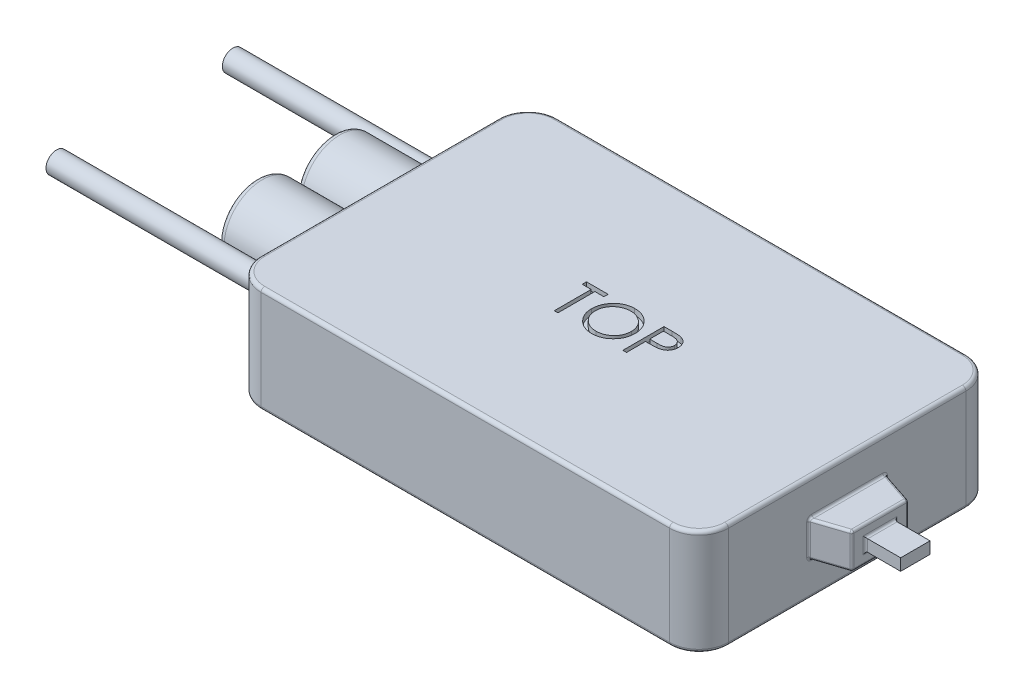
from build123d import *

# Parameters (mm, degrees)
SKETCH1_W                = 39.75
SKETCH1_H                = 25.2
BOSS_EXTRUDE1_DEPTH      = 9
BOSS_EXTRUDE2_DEPTH      = 1.5
BOSS_EXTRUDE2_DEPTH_BACK = 1.5
SKETCH5_W                = 2.5
SKETCH5_H                = 1
BOSS_EXTRUDE3_DEPTH      = 3
SKETCH6_R                = 3.25
BOSS_EXTRUDE5_DEPTH      = 7.2
SKETCH7_R                = 0.9
BOSS_EXTRUDE6_DEPTH      = 20
FILLET1_R                = 2.5
FILLET2_R                = 0.3
FILLET3_R                = 0.5
FILLET4_R                = 0.2
CUT_EXTRUDE1_DEPTH       = 0.5


with BuildPart() as part:
    # Sketch1 → Boss-Extrude1 (new body)
    with BuildSketch(Plane(origin=(0, 0, 0), x_dir=(1, 0, 0), z_dir=(0, 1, 0))):
        Rectangle(SKETCH1_W, SKETCH1_H)
    extrude(amount=BOSS_EXTRUDE1_DEPTH)

    # Sketch4 → Boss-Extrude2 (add, two sides: drawn at the far end of the back side and taken through both)
    with BuildSketch(Plane(origin=(0, 4.5, 0), x_dir=(-1, 0, 0), z_dir=(0, -1, 0)).offset(-BOSS_EXTRUDE2_DEPTH_BACK)):
        Polygon((-19.875, 3.3), (-22.675, 2.375), (-22.675, -2.375), (-19.875, -3.3), align=None)
    extrude(amount=BOSS_EXTRUDE2_DEPTH + BOSS_EXTRUDE2_DEPTH_BACK)

    # Sketch5 → Boss-Extrude3 (add)
    with BuildSketch(Plane(origin=(22.675, 0, 0), x_dir=(0, 0, -1), z_dir=(1, 0, 0))):
        with Locations((0, 4.5)):
            Rectangle(SKETCH5_W, SKETCH5_H)
    extrude(amount=BOSS_EXTRUDE3_DEPTH)

    # Sketch6 → Boss-Extrude5 (add)
    with BuildSketch(Plane.ZY.offset(19.875)):
        with Locations((-3.3, 4.5)):
            Circle(SKETCH6_R)
        with Locations((3.3, 4.5)):
            Circle(SKETCH6_R)
    extrude(amount=BOSS_EXTRUDE5_DEPTH)

    # Sketch7 → Boss-Extrude6 (add)
    with BuildSketch(Plane.ZY.offset(19.875)):
        with Locations((-7.5, 4.5)):
            Circle(SKETCH7_R)
        with Locations((7.5, 4.5)):
            Circle(SKETCH7_R)
    extrude(amount=BOSS_EXTRUDE6_DEPTH)

    # Fillet1
    fillet1_edges = [part.edges().sort_by_distance(p)[0] for p in [
        (19.875, 4.5, -12.6),
        (19.875, 4.5, 12.6),
        (-19.875, 4.5, 12.6),
        (-19.875, 4.5, -12.6),
    ]]
    fillet(fillet1_edges, radius=FILLET1_R)

    # Fillet2
    fillet2_edges = [part.edges().sort_by_distance(p)[0] for p in [
        (-19.142766953, 0, -11.867766953),
        (-19.875, 0, 0),
        (-19.142766953, 0, 11.867766953),
        (0, 0, 12.6),
        (19.142766953, 0, 11.867766953),
        (19.875, 0, 0),
        (19.142766953, 0, -11.867766953),
        (0, 0, -12.6),
        (19.142766953, 9, 11.867766953),
        (0, 9, 12.6),
        (-19.142766953, 9, 11.867766953),
        (-19.875, 9, 0),
        (-19.142766953, 9, -11.867766953),
        (0, 9, -12.6),
        (19.142766953, 9, -11.867766953),
        (19.875, 9, 0),
    ]]
    fillet(fillet2_edges, radius=FILLET2_R)

    # Fillet3
    fillet3_edges = [part.edges().sort_by_distance(p)[0] for p in [
        (-27.075, 4.5, -6.55),
        (-27.075, 4.5, 0.05),
    ]]
    fillet(fillet3_edges, radius=FILLET3_R)

    # Fillet4
    fillet4_edges = [part.edges().sort_by_distance(p)[0] for p in [
        (19.875, 6, 0),
        (19.875, 3, 0),
        (21.275, 6, -2.8375),
        (19.875, 4.5, -3.3),
        (21.275, 3, -2.8375),
        (21.275, 6, 2.8375),
        (21.275, 3, 2.8375),
        (19.875, 4.5, 3.3),
        (22.675, 4.5, -1.25),
        (22.675, 5, 0),
        (22.675, 4.5, 1.25),
        (22.675, 4, 0),
        (22.675, 6, 0),
        (22.675, 4.5, -2.375),
        (22.675, 3, 0),
        (22.675, 4.5, 2.375),
    ]]
    fillet(fillet4_edges, radius=FILLET4_R)

    # Sketch8 → Cut-Extrude1 (cut)
    # profile 1 of 3: a face of its own
    with BuildSketch(Plane(origin=(0, 9, 0), x_dir=(1, 0, 0), z_dir=(0, 1, 0))):
        Polygon((-4.019967979, 1.359639879), (-4.019967979, 1.718614238), (-2.180224389, 1.718614238), (-2.180224389, 1.359639879), (-2.943044902, 1.359639879), (-2.943044902, -1.781385762), (-3.257147466, -1.781385762), (-3.257147466, 1.359639879), align=None)
    # profile 2 of 3: a face of its own
    with BuildSketch(Plane(origin=(0, 9, 0), x_dir=(1, 0, 0), z_dir=(0, 1, 0))):
        with BuildLine():
            add(Edge.make_bspline(
                [(-0.003942338, 1.808357827), (0.060865768, 1.806716348), (0.188154235, 1.803492347), (0.375229133, 1.778813243), (0.553824228, 1.736117853), (0.725394367, 1.679254871), (0.887887344, 1.603400486), (1.042526236, 1.511715337), (1.18894311, 1.403238879), (1.325164491, 1.278809652), (1.449821442, 1.143426198), (1.559647328, 0.998948288), (1.651689622, 0.846249485), (1.727275409, 0.685788655), (1.786574019, 0.517928687), (1.827493062, 0.341774684), (1.853631212, 0.158467994), (1.85668699, 0.033441129), (1.85823715, -0.029983519)],
                knots=[0, 0, 0, 0, 1.065120563, 2.091984664, 3.0946048, 4.079830382, 5.057816894, 6.036188127, 7.030412546, 8.04752943, 9.064399622, 10.05169764, 11.02544977, 11.989514704, 12.962713494, 13.945757189, 14.957906945, 16, 16, 16, 16], degree=3))
            add(Edge.make_bspline(
                [(1.85823715, -0.029983519), (1.856687217, -0.092940965), (1.85363212, -0.217037386), (1.827463343, -0.39918083), (1.786422343, -0.574271526), (1.727826077, -0.742017179), (1.652600598, -0.902594743), (1.559945427, -1.055581697), (1.450804216, -1.201028195), (1.326597365, -1.33734086), (1.191196323, -1.462338331), (1.045966057, -1.571257207), (0.894172737, -1.664981331), (0.733863028, -1.739765005), (0.567162992, -1.799536926), (0.392580669, -1.840289556), (0.210934115, -1.866576599), (0.087063111, -1.869595115), (0.024102534, -1.871129352)],
                knots=[0, 0, 0, 0, 1.043624062, 2.057103931, 3.04512605, 4.022047818, 4.998200453, 5.980619268, 6.982898556, 8.009068085, 9.034988726, 10.034168286, 11.015286542, 11.987931943, 12.962482838, 13.94673481, 14.956375938, 16, 16, 16, 16], degree=3))
            add(Edge.make_bspline(
                [(0.024102534, -1.871129352), (-0.039321785, -1.869579965), (-0.164348001, -1.866525711), (-0.347885036, -1.840344307), (-0.52416278, -1.799403003), (-0.692677131, -1.740893567), (-0.853522061, -1.665276336), (-1.007012144, -1.573071957), (-1.152531291, -1.463664816), (-1.288873037, -1.339498241), (-1.413622235, -1.204326689), (-1.522381611, -1.059492434), (-1.614606724, -0.907836977), (-1.689970057, -0.748939453), (-1.749634516, -0.583568011), (-1.790339334, -0.410619533), (-1.816675286, -0.231080027), (-1.819710133, -0.108837129), (-1.82125003, -0.046810442)],
                knots=[0, 0, 0, 0, 1.053102029, 2.075944431, 3.073151272, 4.055350789, 5.033113405, 6.020478099, 7.024410459, 8.052272461, 9.079885166, 10.07527673, 11.055994387, 12.023226415, 12.992069828, 13.970394897, 14.97016774, 16, 16, 16, 16], degree=3))
            add(Edge.make_bspline(
                [(-1.82125003, -0.046810442), (-1.820715394, -0.005177773), (-1.819652868, 0.077562351), (-1.806861176, 0.200428951), (-1.788299474, 0.321319609), (-1.761697562, 0.439890557), (-1.726905895, 0.555851541), (-1.685853868, 0.670002304), (-1.635714022, 0.781186028), (-1.579033374, 0.88992942), (-1.515771566, 0.994537325), (-1.445895817, 1.093416909), (-1.371860448, 1.187397905), (-1.290697055, 1.274044909), (-1.205080609, 1.355878566), (-1.113622231, 1.431641283), (-1.016879987, 1.502016234), (-0.914437607, 1.565436575), (-0.808819332, 1.622795709), (-0.699942554, 1.67201756), (-0.589285983, 1.714263622), (-0.476331335, 1.748504447), (-0.361378563, 1.775536483), (-0.244176778, 1.793943837), (-0.124819352, 1.806768155), (-0.044408033, 1.807825657), (-0.003942338, 1.808357827)],
                knots=[0, 0, 0, 0, 1.037015668, 2.060948919, 3.074880161, 4.083647147, 5.086022904, 6.090072063, 7.104153813, 8.122640571, 9.144368836, 10.147691507, 11.138137339, 12.123020368, 13.103399296, 14.087645067, 15.080126199, 16.082011238, 17.087798457, 18.072939717, 19.057185487, 20.037253025, 21.01195951, 21.997135196, 22.992090687, 24, 24, 24, 24], degree=3))
        make_face()
        with BuildLine():
            add(Edge.make_bspline(
                [(0.011482342, 1.449383468), (-0.021732292, 1.448978578), (-0.087844025, 1.448172668), (-0.186128561, 1.437556953), (-0.283120495, 1.422427064), (-0.378839857, 1.400845543), (-0.472886146, 1.37144149), (-0.566135987, 1.337600582), (-0.657739041, 1.296379491), (-0.747392899, 1.249806787), (-0.834307974, 1.198257866), (-0.916320676, 1.141286099), (-0.99364332, 1.080227545), (-1.066086586, 1.014939708), (-1.133437759, 0.945090106), (-1.19702246, 0.87173767), (-1.254292042, 0.792785779), (-1.306777618, 0.710375372), (-1.353745459, 0.624613791), (-1.395510813, 0.536403928), (-1.429674822, 0.445026242), (-1.457537199, 0.351472084), (-1.480637009, 0.255889624), (-1.495270934, 0.157553775), (-1.506003293, 0.056958663), (-1.506763138, -0.011023191), (-1.507147466, -0.045408198)],
                knots=[0, 0, 0, 0, 1.008559885, 2.007477868, 2.99961109, 3.989939068, 4.984837346, 5.991145699, 7.001802488, 8.033829008, 9.059044045, 10.069351652, 11.065060232, 12.050310815, 13.029377138, 14.011219647, 14.996725999, 15.989392538, 16.977580475, 17.965360261, 18.951710183, 19.937753436, 20.929683414, 21.935841486, 22.955955122, 24, 24, 24, 24], degree=3))
            add(Edge.make_bspline(
                [(-1.507147466, -0.045408198), (-1.505872604, -0.095970419), (-1.503364556, -0.195441949), (-1.481406986, -0.341210093), (-1.447585011, -0.48129838), (-1.397727645, -0.614940289), (-1.33537703, -0.743284572), (-1.25835014, -0.865192676), (-1.167091055, -0.980697551), (-1.063427528, -1.08899282), (-0.950104821, -1.187838624), (-0.829772091, -1.274602033), (-0.703718484, -1.348012283), (-0.571615281, -1.407817355), (-0.434167742, -1.455207093), (-0.290490191, -1.487685724), (-0.141539732, -1.509061179), (-0.040009076, -1.511113935), (0.011482342, -1.512154993)],
                knots=[0, 0, 0, 0, 1.032063989, 2.030389145, 3.003944642, 3.970395727, 4.937377036, 5.913328081, 6.909231446, 7.93887556, 8.970685674, 9.976071282, 10.964166581, 11.944589148, 12.933237628, 13.927779006, 14.949070134, 16, 16, 16, 16], degree=3))
            add(Edge.make_bspline(
                [(0.011482342, -1.512154993), (0.046091843, -1.511679489), (0.11473288, -1.510736421), (0.216828402, -1.501237744), (0.317084614, -1.486005875), (0.415360894, -1.464075219), (0.511545705, -1.436628013), (0.606040508, -1.404020285), (0.697838799, -1.363339081), (0.788098636, -1.318391129), (0.874494878, -1.267150972), (0.95697041, -1.212112822), (1.03344639, -1.151144201), (1.105835462, -1.086826389), (1.173463151, -1.017862541), (1.235872135, -0.944342319), (1.292852267, -0.865801662), (1.345317914, -0.783516256), (1.392121176, -0.697520004), (1.432900275, -0.608990326), (1.467496391, -0.518145216), (1.495424896, -0.424853645), (1.517310358, -0.329292796), (1.532390278, -0.231334718), (1.542938716, -0.131175375), (1.543733794, -0.063431519), (1.544134585, -0.029282397)],
                knots=[0, 0, 0, 0, 1.047197238, 2.076906641, 3.100256066, 4.114471768, 5.12198147, 6.126382909, 7.136867548, 8.15857795, 9.17633901, 10.174870724, 11.156907918, 12.133735059, 13.104061851, 14.077631395, 15.04955518, 16.038496417, 17.029181396, 18.010275684, 18.986308667, 19.968651475, 20.955262928, 21.950658345, 22.966943676, 24, 24, 24, 24], degree=3))
            add(Edge.make_bspline(
                [(1.544134585, -0.029282397), (1.543733472, 0.004633107), (1.542937791, 0.071910757), (1.532395316, 0.171371576), (1.517294426, 0.268624787), (1.495531718, 0.36328859), (1.467481564, 0.455387115), (1.432894234, 0.544833863), (1.392108934, 0.631962058), (1.34530071, 0.716556355), (1.292684886, 0.797731093), (1.235190643, 0.875333506), (1.171825295, 0.947906247), (1.10439927, 1.017240941), (1.031228385, 1.081858831), (0.952644091, 1.141781351), (0.869600413, 1.198454625), (0.781673178, 1.249580187), (0.690929224, 1.29679442), (0.597815266, 1.337245423), (0.503386166, 1.371617543), (0.407882054, 1.400934508), (0.310499076, 1.422342538), (0.211895247, 1.437570588), (0.112206988, 1.448168973), (0.045163768, 1.448977352), (0.011482342, 1.449383468)],
                knots=[0, 0, 0, 0, 1.02996197, 2.043119294, 3.035359645, 4.018872909, 4.991431989, 5.957985074, 6.929999688, 7.912076566, 8.892894881, 9.867085534, 10.843653904, 11.817741046, 12.803660682, 13.806313499, 14.818574707, 15.856120519, 16.894564902, 17.924820532, 18.937903209, 19.946497019, 20.957711757, 21.963978472, 22.977135795, 24, 24, 24, 24], degree=3))
        make_face(mode=Mode.SUBTRACT)
    # profile 3 of 3: a face of its own
    with BuildSketch(Plane(origin=(0, 9, 0), x_dir=(1, 0, 0), z_dir=(0, 1, 0))):
        with BuildLine():
            Line((2.576185867, 1.718614238), (3.262584105, 1.718614238))
            add(Edge.make_bspline(
                [(3.262584105, 1.718614238), (3.309795011, 1.718562341), (3.400253204, 1.718462906), (3.529968259, 1.71544816), (3.647777991, 1.711421468), (3.753428372, 1.705839575), (3.84724447, 1.699242984), (3.92880177, 1.689990945), (3.998741326, 1.680330649), (4.040647775, 1.670509243), (4.059759585, 1.666030103)],
                knots=[0, 0, 0, 0, 1.415646017, 2.712440637, 3.8905458, 4.950247383, 5.884950622, 6.709939814, 7.411656543, 8, 8, 8, 8], degree=3))
            add(Edge.make_bspline(
                [(4.059759585, 1.666030103), (4.083953119, 1.659408153), (4.131770096, 1.646320291), (4.20067114, 1.620106568), (4.266224985, 1.589024403), (4.328656543, 1.553600463), (4.387198627, 1.512314899), (4.442724667, 1.466841281), (4.494744648, 1.416129712), (4.54296604, 1.360748973), (4.587250837, 1.301628763), (4.62538052, 1.237886533), (4.657307747, 1.170595229), (4.684691018, 1.099801658), (4.704399473, 1.024911335), (4.719246373, 0.946444622), (4.72867, 0.864409932), (4.729572562, 0.808350065), (4.730032021, 0.779812154)],
                knots=[0, 0, 0, 0, 0.999701418, 1.975846123, 2.934577507, 3.890451536, 4.834027766, 5.787354733, 6.749476667, 7.726910423, 8.712836071, 9.690891519, 10.682875813, 11.679750201, 12.712814741, 13.765529915, 14.8625177, 16, 16, 16, 16], degree=3))
            add(Edge.make_bspline(
                [(4.730032021, 0.779812154), (4.729610597, 0.751034377), (4.728786051, 0.694728713), (4.718889765, 0.612355925), (4.705559574, 0.533637535), (4.685062521, 0.458748085), (4.658216848, 0.388132314), (4.626724795, 0.320711082), (4.588741265, 0.25763141), (4.545096435, 0.198664293), (4.496544841, 0.14375438), (4.443291903, 0.093299586), (4.38555261, 0.047595248), (4.323510462, 0.006538904), (4.256560613, -0.028917376), (4.18571846, -0.060674681), (4.110368243, -0.087345741), (4.058225729, -0.101375803), (4.031714714, -0.10850916)],
                knots=[0, 0, 0, 0, 1.121902311, 2.195077645, 3.232258892, 4.234102512, 5.217864754, 6.176164875, 7.132989551, 8.084763148, 9.034132444, 9.988522005, 10.94243251, 11.903244335, 12.886203696, 13.894208494, 14.929344452, 16, 16, 16, 16], degree=3))
            add(Edge.make_bspline(
                [(4.031714714, -0.10850916), (4.00978738, -0.113172141), (3.961732352, -0.123391335), (3.88258963, -0.134799792), (3.790444244, -0.144537393), (3.685421964, -0.15183853), (3.567617059, -0.158088899), (3.436965802, -0.163056993), (3.293211725, -0.165786846), (3.192940481, -0.165927639), (3.140588912, -0.166001147)],
                knots=[0, 0, 0, 0, 0.601384939, 1.31797006, 2.144135048, 3.087295005, 4.142315834, 5.309527816, 6.595305764, 8, 8, 8, 8], degree=3))
            Line((3.140588912, -0.166001147), (2.890288432, -0.166001147))
            Line((2.890288432, -0.166001147), (2.890288432, -1.781385762))
            Line((2.890288432, -1.781385762), (2.576185867, -1.781385762))
            Line((2.576185867, -1.781385762), (2.576185867, 1.718614238))
        make_face()
        with BuildLine():
            Line((2.890288432, 1.359639879), (2.890288432, 0.192973212))
            Line((2.890288432, 0.192973212), (3.50306888, 0.185260872))
            add(Edge.make_bspline(
                [(3.50306888, 0.185260872), (3.532988806, 0.185245409), (3.590748606, 0.185215556), (3.674184829, 0.18920078), (3.751594117, 0.193801313), (3.822738692, 0.200537236), (3.887650626, 0.210058494), (3.946438155, 0.219670231), (3.998645438, 0.233575594), (4.05974464, 0.252298663), (4.127827987, 0.284231279), (4.201895536, 0.330581169), (4.264666122, 0.389661877), (4.318984419, 0.456089708), (4.362090297, 0.529988838), (4.393646289, 0.609057775), (4.412187447, 0.692485624), (4.41467364, 0.749573763), (4.415929457, 0.778409911)],
                knots=[0, 0, 0, 0, 1.160613943, 2.240541288, 3.23993089, 4.169200891, 5.011653406, 5.7853311, 6.478053781, 7.106038997, 8.262395093, 9.384106736, 10.481365981, 11.59014053, 12.70357646, 13.786202915, 14.881775077, 16, 16, 16, 16], degree=3))
            add(Edge.make_bspline(
                [(4.415929457, 0.778409911), (4.414666811, 0.806548424), (4.412156826, 0.862484306), (4.393500963, 0.944463067), (4.362151649, 1.022698771), (4.318695054, 1.095671857), (4.265953924, 1.161860661), (4.204654581, 1.219357788), (4.13494132, 1.26557949), (4.070093089, 1.295412772), (4.012491903, 1.313628047), (3.962459943, 1.326372888), (3.905969268, 1.336548494), (3.843001489, 1.344787997), (3.774044655, 1.351841458), (3.69850634, 1.356627435), (3.616672697, 1.359428892), (3.559862126, 1.359567847), (3.53041263, 1.359639879)],
                knots=[0, 0, 0, 0, 1.120700087, 2.227813068, 3.331159281, 4.466773991, 5.599788987, 6.693661531, 7.80175334, 8.91857717, 9.525282508, 10.207424825, 10.974604443, 11.810962634, 12.737642355, 13.736264703, 14.826523623, 16, 16, 16, 16], degree=3))
            Line((3.53041263, 1.359639879), (2.890288432, 1.359639879))
        make_face(mode=Mode.SUBTRACT)
    extrude(amount=-CUT_EXTRUDE1_DEPTH, mode=Mode.SUBTRACT)


solid = part.part
